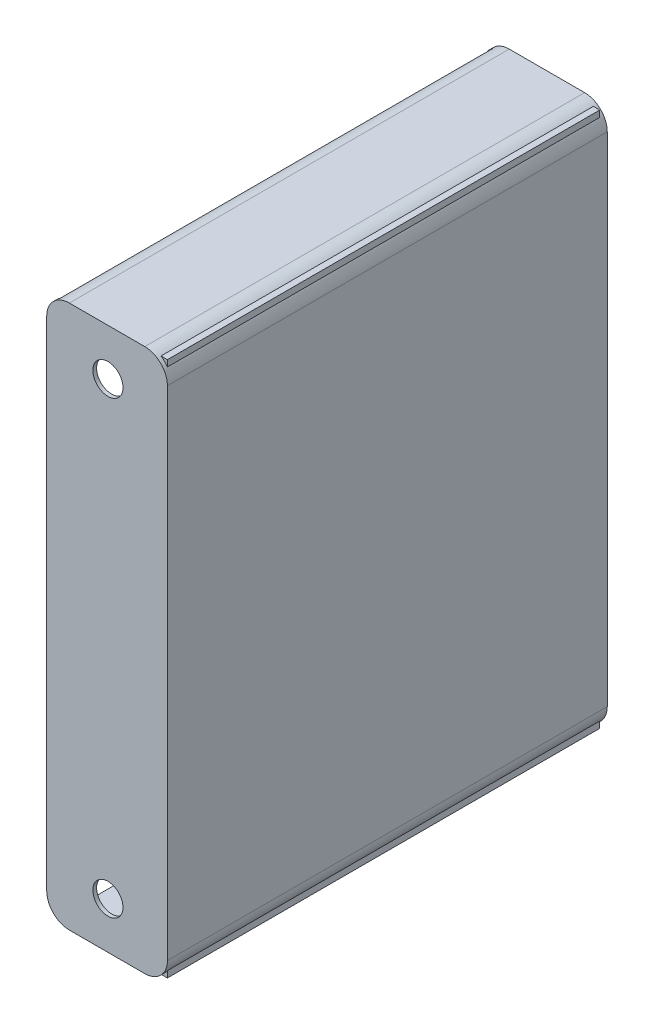
from build123d import *

# Parameters (mm, degrees)
SKETCH1_W           = 740.664
SKETCH1_H           = 914.4
BOSS_EXTRUDE1_DEPTH = 203.2
SHELL1_T            = -6.35
SKETCH4_R           = 25.4
CUT_EXTRUDE1_DEPTH  = 853.694
FILLET1_R           = 38.1
SCALE1_SCALE        = 0.5867


with BuildPart() as part:
    # Sketch1 → Boss-Extrude1 (new body)
    with BuildSketch(Plane(origin=(0, 0, 0), x_dir=(0, 0, -1), z_dir=(1, 0, 0))):
        Rectangle(SKETCH1_W, SKETCH1_H)
    extrude(amount=BOSS_EXTRUDE1_DEPTH)

    # Shell1
    shell1_openings = [part.faces().sort_by_distance(p)[0] for p in [
        (0, 0, 0),
    ]]
    offset(amount=SHELL1_T, openings=shell1_openings, kind=Kind.INTERSECTION)

    # Sketch4 → Cut-Extrude1 (cut)
    with BuildSketch(Plane.XY.offset(370.332)):
        with Locations((103.042772695, 378.994204807)):
            Circle(SKETCH4_R)
    cut_extrude1 = extrude(amount=-CUT_EXTRUDE1_DEPTH, mode=Mode.SUBTRACT)

    # Mirror1: Cut-Extrude1 across plane
    add(cut_extrude1.mirror(Plane.ZX), mode=Mode.SUBTRACT)

    # Fillet1
    fillet1_edges = [part.edges().sort_by_distance(p)[0] for p in [
        (203.2, -457.2, 0),
    ]]
    fillet(fillet1_edges, radius=FILLET1_R)
    fillet1_2_edges = [part.edges().sort_by_distance(p)[0] for p in [
        (203.2, 457.2, 0),
    ]]
    fillet(fillet1_2_edges, radius=FILLET1_R)
    # the kernel refuses this fillet: 38.1 mm, written as the material it takes off along each edge
    with BuildSketch(Plane(origin=(0, -457.2, -465.582), x_dir=(1, 0, 0), z_dir=(0, 0, 1))) as fillet1_3_piece_1:
        with BuildLine():
            CenterArc((FILLET1_R, FILLET1_R), FILLET1_R, 180, 90)
            Line((0, FILLET1_R), (-FILLET1_R * 0.02, FILLET1_R))
            Line((-FILLET1_R * 0.02, FILLET1_R), (-FILLET1_R * 0.02, -FILLET1_R * 0.02))
            Line((-FILLET1_R * 0.02, -FILLET1_R * 0.02), (FILLET1_R, -FILLET1_R * 0.02))
            Line((FILLET1_R, -FILLET1_R * 0.02), (FILLET1_R, 0))
        make_face()
    extrude(amount=931.164, mode=Mode.SUBTRACT)
    # the kernel refuses this fillet: 38.1 mm, written as the material it takes off along each edge
    with BuildSketch(Plane(origin=(0, 457.2, 465.582), x_dir=(1, 0, 0), z_dir=(0, 0, -1))) as fillet1_4_piece_1:
        with BuildLine():
            CenterArc((FILLET1_R, FILLET1_R), FILLET1_R, 180, 90)
            Line((0, FILLET1_R), (-FILLET1_R * 0.02, FILLET1_R))
            Line((-FILLET1_R * 0.02, FILLET1_R), (-FILLET1_R * 0.02, -FILLET1_R * 0.02))
            Line((-FILLET1_R * 0.02, -FILLET1_R * 0.02), (FILLET1_R, -FILLET1_R * 0.02))
            Line((FILLET1_R, -FILLET1_R * 0.02), (FILLET1_R, 0))
        make_face()
    extrude(amount=931.164, mode=Mode.SUBTRACT)


with BuildPart() as part_1:
    # Scale1: scaled about (152.162233958, 0, 0)
    add(part.part.scale(SCALE1_SCALE).moved(Location((62.888651295, 0, 0))))


solid = part_1.part
